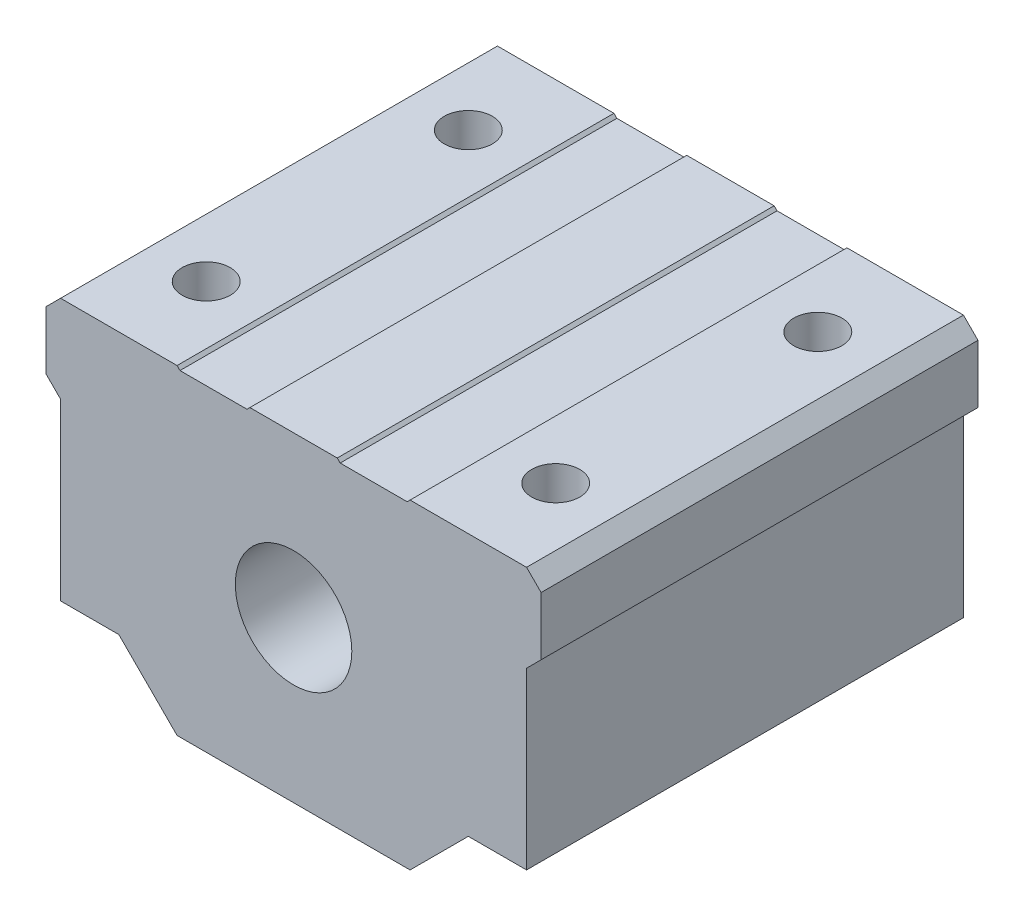
from build123d import *

# Parameters (mm, degrees)
BOSS_EXTRUDE1_DEPTH     = 30
SKETCH2_R               = 4
CUT_EXTRUDE1_DEPTH      = 41.902322672
CHAMFER1_SIZE           = 1
CUT_EXTRUDE3_DEPTH      = 41.902322672
CUT_EXTRUDE3_DEPTH_BACK = 41.902322672
SKETCH7_R               = 1.5
M4_TAPPED_HOLE1_D       = 3.3
M4_TAPPED_HOLE1_DEPTH   = 8
M4_TAPPED_HOLE1_TIP     = 0.991420021
CUT_EXTRUDE4_DEPTH      = 41.902322672


with BuildPart() as part:
    # Sketch1 → Boss-Extrude1 (new body)
    with BuildSketch(Plane.XY):
        Polygon((8, 0), (-8, 0), (-12, 4), (-16, 4), (-16, 16), (-17, 16), (-17, 22), (17, 22), (17, 16), (16, 16), (16, 4), (12, 4), align=None)
    extrude(amount=BOSS_EXTRUDE1_DEPTH)

    # Sketch2 → Cut-Extrude1 (cut, through all)
    with BuildSketch(Plane.XY.offset(30)):
        with Locations((0, 11)):
            Circle(SKETCH2_R)
    extrude(amount=-CUT_EXTRUDE1_DEPTH, mode=Mode.SUBTRACT)

    # Chamfer1
    chamfer1_edges = [part.edges().sort_by_distance(p)[0] for p in [
        (-17, 16, 15),
        (17, 16, 15),
        (-17, 22, 15),
        (17, 22, 15),
    ]]
    chamfer(chamfer1_edges, length=CHAMFER1_SIZE - 0.0001)  # a hair under: the kernel refuses the full size

    # Sketch7 → Cut-Extrude3 (cut, two sides: drawn at the far end of the back side and taken through both)
    with BuildSketch(Plane(origin=(0, 22, 0), x_dir=(1, 0, 0), z_dir=(0, 1, 0)).offset(-CUT_EXTRUDE3_DEPTH_BACK)):
        with Locations(Location((-12, -6, 0), (0, 0, 90))):
            Circle(SKETCH7_R)
        with Locations(Location((-12, -24, 0), (0, 0, 90))):
            Circle(SKETCH7_R)
        with Locations(Location((12, -6, 0), (0, 0, 90))):
            Circle(SKETCH7_R)
        with Locations(Location((12, -24, 0), (0, 0, 90))):
            Circle(SKETCH7_R)
    extrude(amount=CUT_EXTRUDE3_DEPTH + CUT_EXTRUDE3_DEPTH_BACK, mode=Mode.SUBTRACT)

    # M4 Tapped Hole1
    with Locations(Plane(origin=(0, 22, 0), x_dir=(1, 0, 0), z_dir=(0, 1, 0))):
        with Locations((-12, -6), (12, -6), (-12, -24), (12, -24)):
            Hole(M4_TAPPED_HOLE1_D / 2, depth=M4_TAPPED_HOLE1_DEPTH)
            with Locations((0, 0, -(M4_TAPPED_HOLE1_DEPTH + M4_TAPPED_HOLE1_TIP / 2))):  # 118° drill point
                Cone(0, M4_TAPPED_HOLE1_D / 2, M4_TAPPED_HOLE1_TIP, mode=Mode.SUBTRACT)

    # Sketch8 → Cut-Extrude4 (cut, through all)
    with BuildSketch(Plane(origin=(0, 0, 0), x_dir=(-1, 0, 0), z_dir=(0, 0, -1))):
        Polygon((8, 22), (3, 22), (3.2, 21.8), (7.8, 21.8), align=None)
        Polygon((-3, 22), (-8, 22), (-7.8, 21.8), (-3.2, 21.8), align=None)
    extrude(amount=-CUT_EXTRUDE4_DEPTH, mode=Mode.SUBTRACT)


solid = part.part
